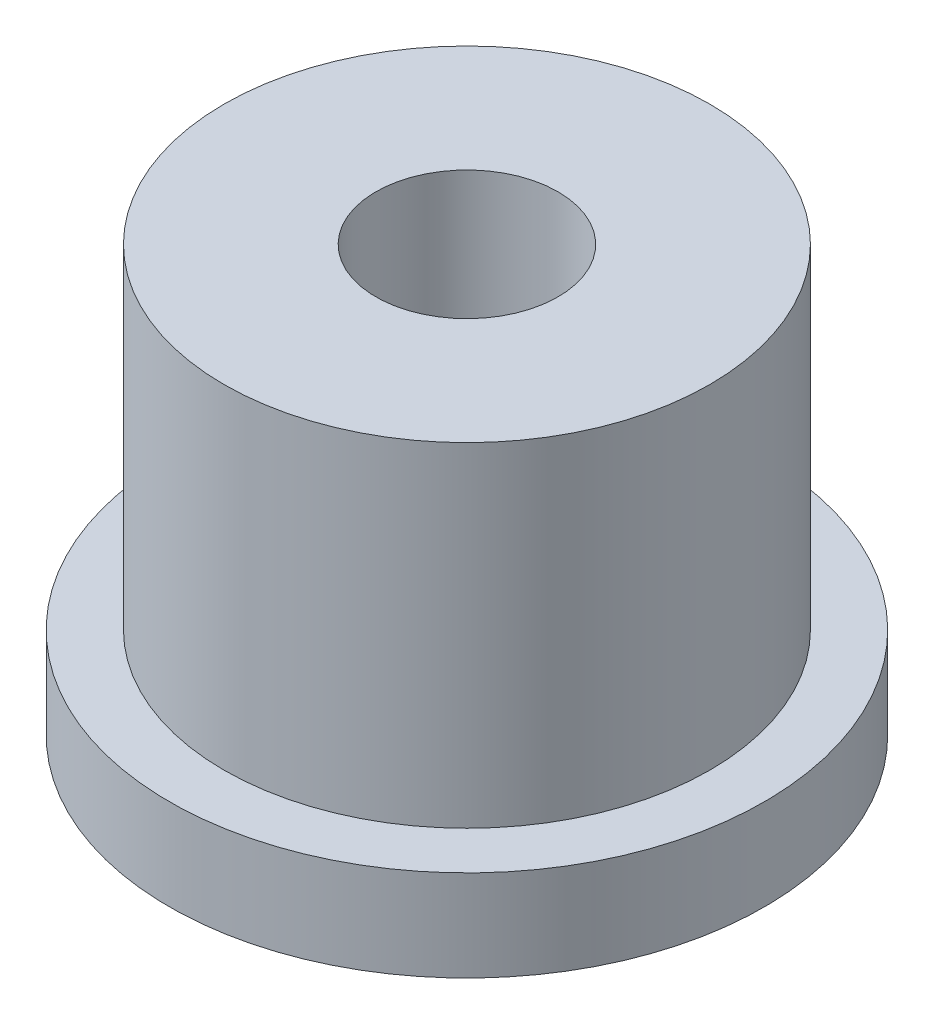
from build123d import *


with BuildPart() as part:
    # Szkic1 → Obrót1 (revolve)
    with BuildSketch(Plane.XY):
        Polygon((1.5, 2), (1.5, 7), (4, 7), (4, 1.5), (4.9, 1.5), (4.9, 0), (2.75, 0), (2.75, 2), align=None)
    revolve(axis=Axis((0, 0, 0), (0, 1, 0)))


solid = part.part
